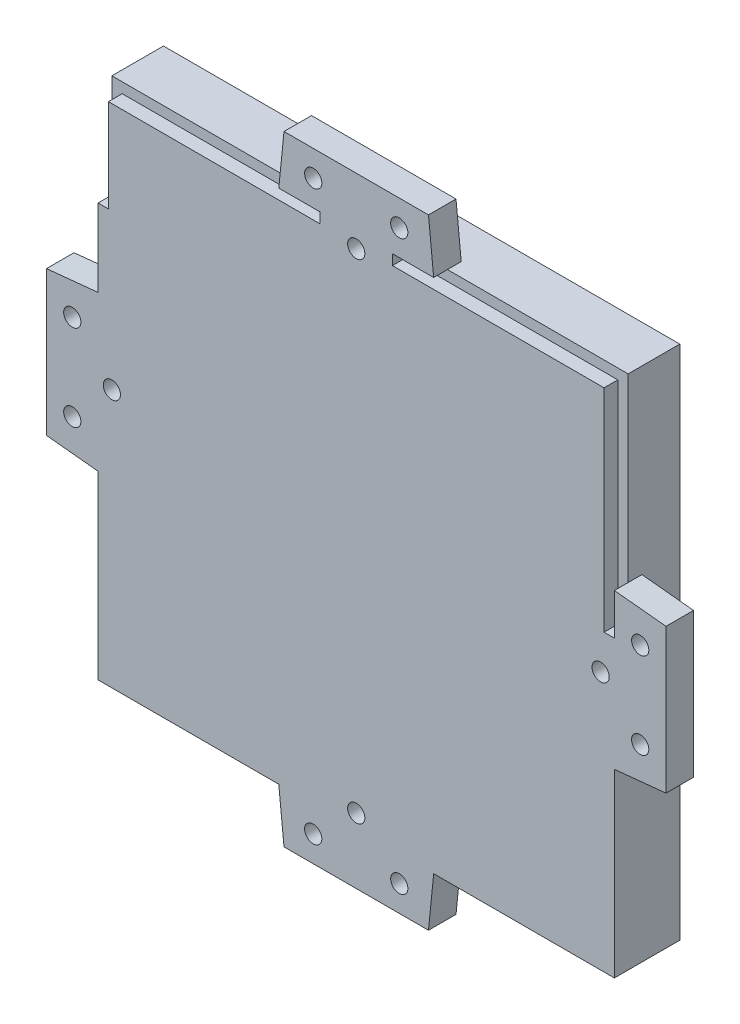
from build123d import *

# Parameters (mm, degrees)
SKETCH1_R           = 2.5
BOSS_EXTRUDE1_DEPTH = 4
BOSS_EXTRUDE3_DEPTH = 15


with BuildPart() as part:
    # Sketch1 → Boss-Extrude1 (new, symmetric)
    with BuildSketch(Plane.XY):
        Polygon((-22.500000003, -75), (-20.989689791, -90), (20.989689791, -90), (22.499999997, -74.99999999), (75, -75), (75, -22.500000003), (90, -20.989689791), (90, 20.989689791), (74.99999999, 22.499999997), (75, 10.499999996), (72, 10.499999996), (72, 72), (10.500000004, 72), (10.500000004, 75), (22.500000003, 75), (20.989689791, 90), (-20.989689791, 90), (-22.499999997, 74.99999999), (-10.499999996, 75), (-10.499999996, 72), (-72, 72), (-72, 45), (-75, 45), (-75, 22.500000003), (-90, 20.989689791), (-90, -20.989689791), (-74.99999999, -22.499999997), (-75, -75), align=None)
        with Locations((-12.500000002, -82.499999998)):
            Circle(SKETCH1_R, mode=Mode.SUBTRACT)
        with Locations((12.499999998, -82.499999992)):
            Circle(SKETCH1_R, mode=Mode.SUBTRACT)
        with Locations((-4e-09, -70.999999995)):
            Circle(SKETCH1_R, mode=Mode.SUBTRACT)
        with Locations((-82.499999998, 12.500000002)):
            Circle(SKETCH1_R, mode=Mode.SUBTRACT)
        with Locations((-82.499999992, -12.499999998)):
            Circle(SKETCH1_R, mode=Mode.SUBTRACT)
        with Locations((-70.999999995, 4e-09)):
            Circle(SKETCH1_R, mode=Mode.SUBTRACT)
        with Locations((70.999999995, -4e-09)):
            Circle(SKETCH1_R, mode=Mode.SUBTRACT)
        with Locations((82.499999992, 12.499999998)):
            Circle(SKETCH1_R, mode=Mode.SUBTRACT)
        with Locations((82.499999998, -12.500000002)):
            Circle(SKETCH1_R, mode=Mode.SUBTRACT)
        with Locations((4e-09, 70.999999995)):
            Circle(SKETCH1_R, mode=Mode.SUBTRACT)
        with Locations((12.500000002, 82.499999998)):
            Circle(SKETCH1_R, mode=Mode.SUBTRACT)
        with Locations((-12.499999998, 82.499999992)):
            Circle(SKETCH1_R, mode=Mode.SUBTRACT)
    extrude(amount=BOSS_EXTRUDE1_DEPTH, both=True)

    # Sketch1<4> → Boss-Extrude3 (add)
    with BuildSketch(Plane.XY):
        Polygon((-75, -75), (-10.500000004, -75), (-10.500000004, -72), (-72, -72), (-72, -10.499999996), (-75, -10.499999996), align=None)
        Polygon((10.499999996, -75), (75, -75), (75, -10.500000004), (72, -10.500000004), (72, -72), (10.499999996, -72), align=None)
        Polygon((-75, 10.500000004), (-72, 10.500000004), (-72, 72), (-10.499999996, 72), (-10.499999996, 75), (-75, 75), align=None)
        Polygon((75, 10.499999996), (75, 75), (10.500000004, 75), (10.500000004, 72), (72, 72), (72, 10.499999996), align=None)
    extrude(amount=-BOSS_EXTRUDE3_DEPTH)


solid = part.part
